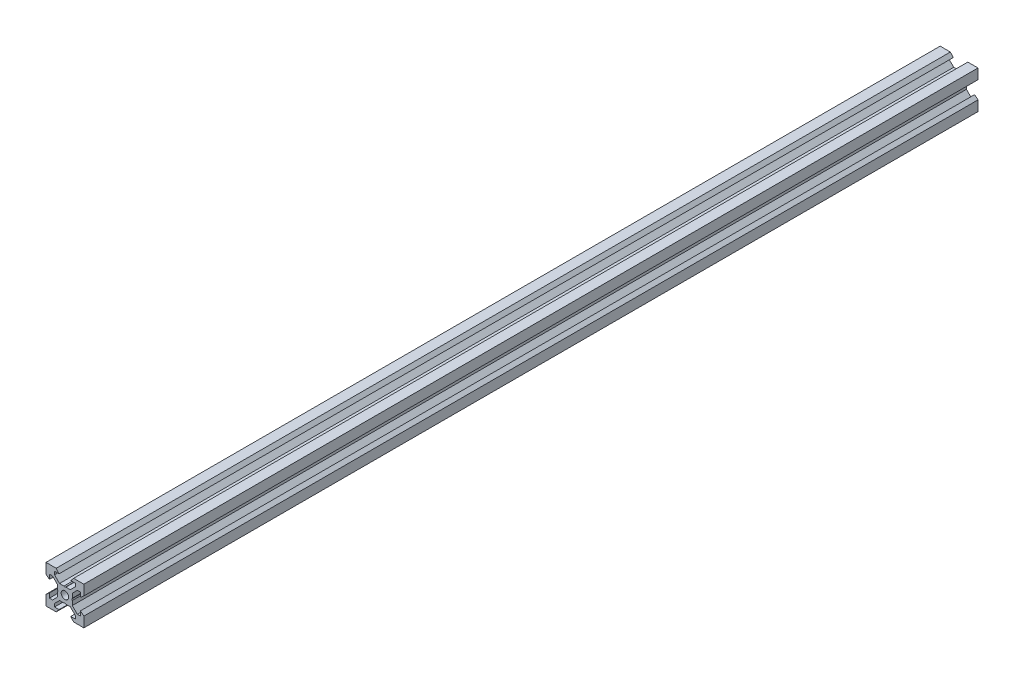
from build123d import *

# Parameters (mm, degrees)
SKETCH1_R           = 2
BOSS_EXTRUDE1_DEPTH = 236.345


with BuildPart() as part:
    # Sketch1 → Boss-Extrude1 (new, symmetric)
    with BuildSketch(Plane.XY):
        Polygon((10, 4.610379336), (10, 10), (4.610379336, 10), (3.1, 8.2), (5.5, 8.2), (5.5, 6.560660172), (2.839339828, 3.9), (0.519615242, 3.9), (0, 3.6), (-0.519615242, 3.9), (-2.839339828, 3.9), (-5.5, 6.560660172), (-5.5, 8.2), (-3.1, 8.2), (-4.610379336, 10), (-10, 10), (-10, 4.610379336), (-8.2, 3.1), (-8.2, 5.5), (-6.560660172, 5.5), (-3.9, 2.839339828), (-3.9, 0.519615242), (-3.6, 0), (-3.9, -0.519615242), (-3.9, -2.839339828), (-6.560660172, -5.5), (-8.2, -5.5), (-8.2, -3.1), (-10, -4.610379336), (-10, -10), (-4.610379336, -10), (-3.1, -8.2), (-5.5, -8.2), (-5.5, -6.560660172), (-2.839339828, -3.9), (-0.519615242, -3.9), (0, -3.6), (0.519615242, -3.9), (2.839339828, -3.9), (5.5, -6.560660172), (5.5, -8.2), (3.1, -8.2), (4.610379336, -10), (10, -10), (10, -4.610379336), (8.2, -3.1), (8.2, -5.5), (6.560660172, -5.5), (3.9, -2.839339828), (3.9, -0.519615242), (3.6, 0), (3.9, 0.519615242), (3.9, 2.839339828), (6.560660172, 5.5), (8.2, 5.5), (8.2, 3.1), align=None)
        Circle(SKETCH1_R, mode=Mode.SUBTRACT)
    extrude(amount=BOSS_EXTRUDE1_DEPTH, both=True)


solid = part.part
